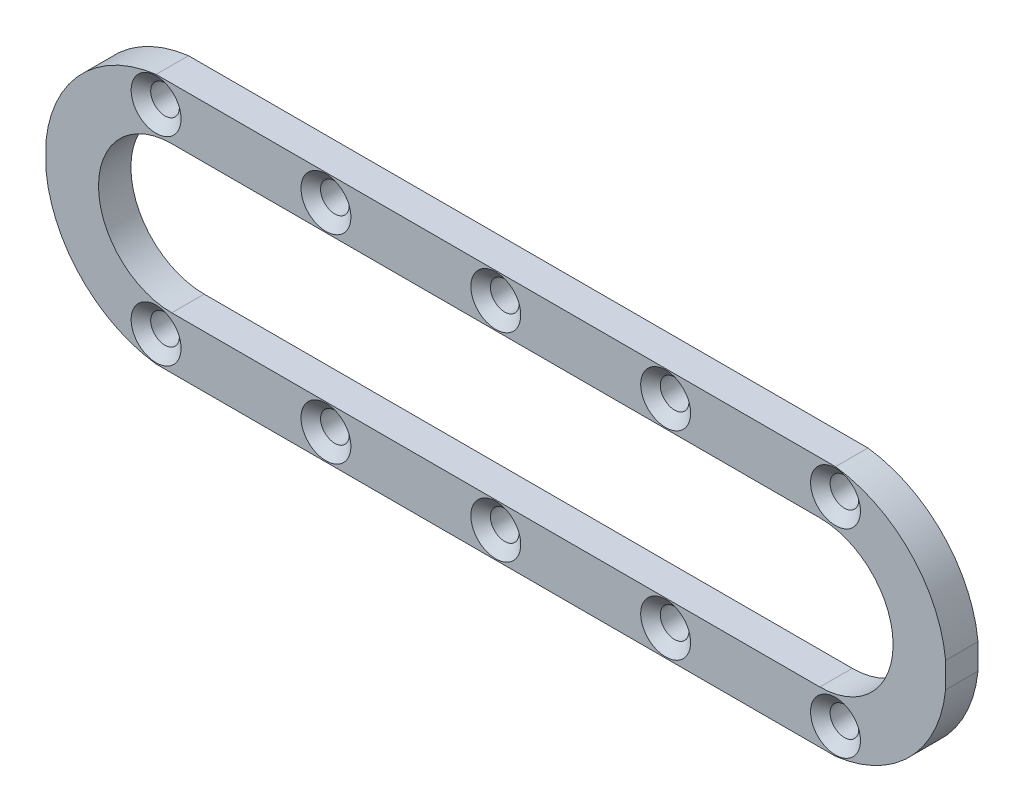
from build123d import *

# Parameters (mm, degrees)
SKETCH1_W                                          = 176.276
SKETCH1_H                                          = 49.149
BOSS_EXTRUDE1_DEPTH                                = 6.35
CUT_EXTRUDE1_DEPTH                                 = 92.719875677
CUT_EXTRUDE4_DEPTH                                 = 92.719875677
CSK_FOR_10_FLAT_HEAD_MACHINE_SCREW_100_D           = 5.6134
CSK_FOR_10_FLAT_HEAD_MACHINE_SCREW_100_CSINK_D     = 9.779
CSK_FOR_10_FLAT_HEAD_MACHINE_SCREW_100_CSINK_ANGLE = 100


with BuildPart() as part:
    # Sketch1 → Boss-Extrude1 (new body)
    with BuildSketch(Plane.XY):
        Rectangle(SKETCH1_W, SKETCH1_H)
    extrude(amount=BOSS_EXTRUDE1_DEPTH)

    # Sketch2 → Cut-Extrude1 (cut, through all)
    with BuildSketch(Plane.XY.offset(6.35)):
        with BuildLine():
            Line((63.5, -14.351), (-63.5, -14.351))
            ThreePointArc((-63.5, -14.351), (-77.851, 0), (-63.5, 14.351))
            Line((-63.5, 14.351), (63.5, 14.351))
            ThreePointArc((63.5, 14.351), (77.851, 0), (63.5, -14.351))
        make_face()
    extrude(amount=-CUT_EXTRUDE1_DEPTH, mode=Mode.SUBTRACT)

    # Sketch8 → Cut-Extrude4 (cut, through all)
    with BuildSketch(Plane.XY.offset(6.35)):
        with BuildLine():
            ThreePointArc((-88.138, 2.504831531), (-81.209963357, 17.310760321), (-66.565807357, 24.5745))
            Line((-66.565807357, 24.5745), (-88.138, 24.5745))
            Line((-88.138, 24.5745), (-88.138, 2.504831531))
        make_face()
        with BuildLine():
            Line((88.138, 24.5745), (66.565807357, 24.5745))
            ThreePointArc((66.565807357, 24.5745), (81.209963357, 17.310760321), (88.138, 2.504831531))
            Line((88.138, 2.504831531), (88.138, 24.5745))
        make_face()
        with BuildLine():
            ThreePointArc((-66.565807357, -24.5745), (-81.209963357, -17.310760321), (-88.138, -2.504831531))
            Line((-88.138, -2.504831531), (-88.138, -24.5745))
            Line((-88.138, -24.5745), (-66.565807357, -24.5745))
        make_face()
        with BuildLine():
            Line((88.138, -24.5745), (88.138, -2.504831531))
            ThreePointArc((88.138, -2.504831531), (81.209963357, -17.310760321), (66.565807357, -24.5745))
            Line((66.565807357, -24.5745), (88.138, -24.5745))
        make_face()
    extrude(amount=-CUT_EXTRUDE4_DEPTH, mode=Mode.SUBTRACT)

    # CSK for #10 Flat Head Machine Screw (100)2 (through all)
    with Locations(Plane.XY.offset(6.35)):
        with Locations((-66.565807357, 19.46275), (-33.282903678, 19.46275), (0, 19.46275), (33.282903678, 19.46275), (66.565807357, 19.46275), (66.565807357, -19.46275), (33.282903678, -19.46275), (0, -19.46275), (-33.282903678, -19.46275), (-66.565807357, -19.46275)):
            CounterSinkHole(CSK_FOR_10_FLAT_HEAD_MACHINE_SCREW_100_D / 2, CSK_FOR_10_FLAT_HEAD_MACHINE_SCREW_100_CSINK_D / 2, counter_sink_angle=CSK_FOR_10_FLAT_HEAD_MACHINE_SCREW_100_CSINK_ANGLE)


solid = part.part
